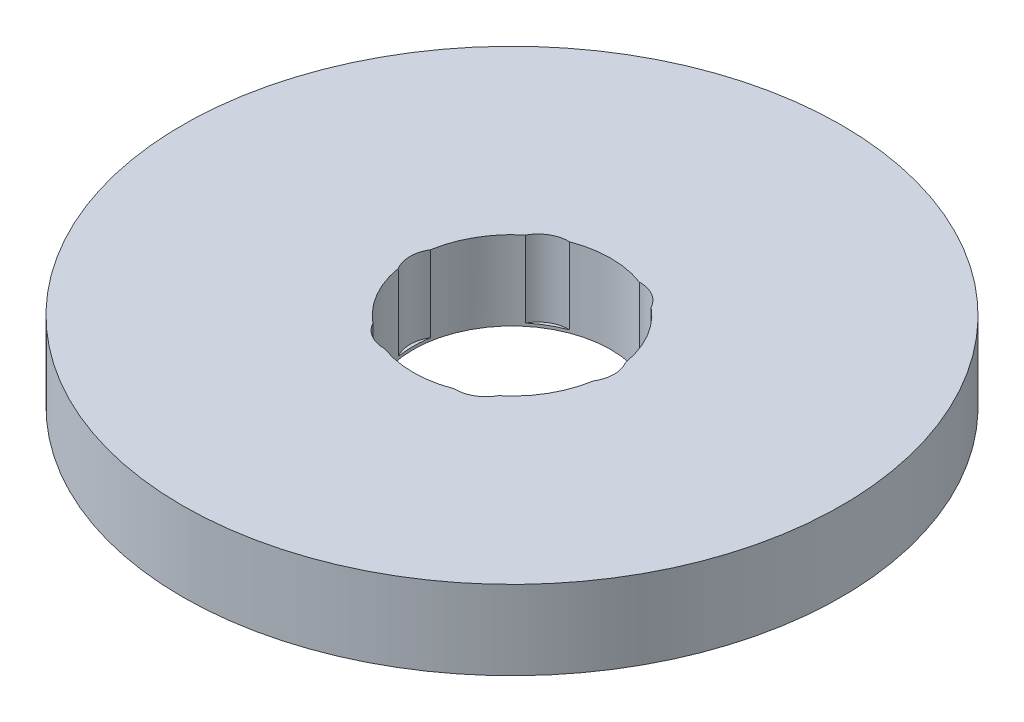
from build123d import *

# Parameters (mm, degrees)
SKETCH1_R           = 75
BOSS_EXTRUDE1_DEPTH = 18
SKETCH2_R           = 22.5
CUT_EXTRUDE1_DEPTH  = 108.582526462
SKETCH3_R           = 7.038578901
CUT_EXTRUDE2_DEPTH  = 17.347447455
CIRPATTERN1_COUNT   = 6


with BuildPart() as part:
    # Sketch1 → Boss-Extrude1 (new body)
    with BuildSketch(Plane(origin=(0, 0, 0), x_dir=(1, 0, 0), z_dir=(0, 1, 0))):
        Circle(SKETCH1_R)
    extrude(amount=BOSS_EXTRUDE1_DEPTH)

    # Sketch2 → Cut-Extrude1 (cut, through all)
    with BuildSketch(Plane(origin=(0, 0, 0), x_dir=(1, 0, 0), z_dir=(0, 1, 0))):
        Circle(SKETCH2_R)
    extrude(amount=CUT_EXTRUDE1_DEPTH, mode=Mode.SUBTRACT)

    # Sketch3 → Cut-Extrude2 (cut)
    with BuildSketch(Plane(origin=(0, 18, 0), x_dir=(1, 0, 0), z_dir=(0, 1, 0))):
        with Locations((-16.1880081, 0)):
            Circle(SKETCH3_R)
    cut_extrude2 = extrude(amount=-CUT_EXTRUDE2_DEPTH, mode=Mode.SUBTRACT)

    # CirPattern1: Cut-Extrude2 ×6 about axis
    cirpattern1_axis = Axis((0, 0, 0), (0, 1, 0))
    for i in range(1, CIRPATTERN1_COUNT):
        add(cut_extrude2.rotate(cirpattern1_axis, i * 360 / CIRPATTERN1_COUNT), mode=Mode.SUBTRACT)


solid = part.part
